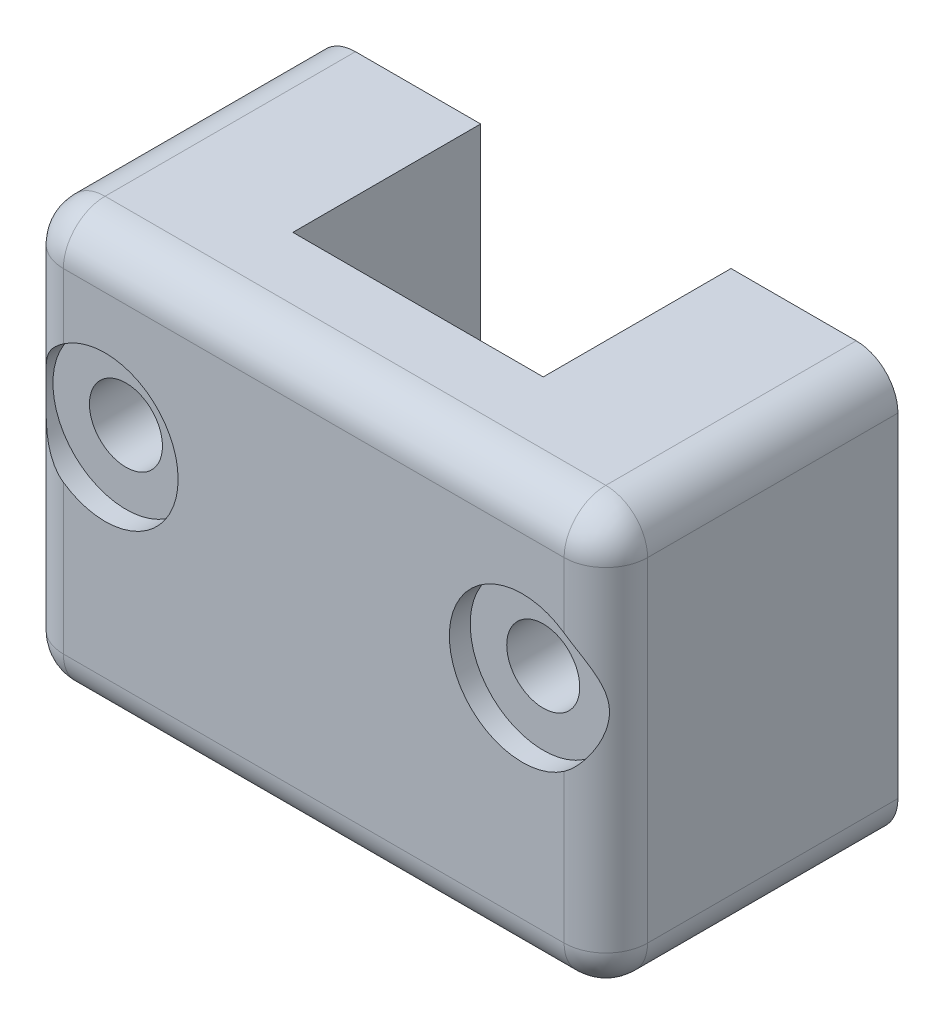
from build123d import *

# Parameters (mm, degrees)
SKETCH1_W                = 42
SKETCH1_H                = 14
BOSS_EXTRUDE1_DEPTH      = 20
SKETCH2_W                = 11
SKETCH2_H                = 10
CUT_EXTRUDE1_DEPTH       = 33.202484376
SKETCH3_W                = 11
SKETCH3_H                = 10
CUT_EXTRUDE2_DEPTH       = 33.202484376
SKETCH4_W                = 12
SKETCH4_H                = 10
CUT_EXTRUDE3_DEPTH       = 33.202484376
F_4_0_4_DIAMETER_HOLE1_D = 4
FILLET1_R                = 1
SKETCH7_W                = 53.135320533
SKETCH7_H                = 18.013507302
CUT_EXTRUDE4_DEPTH       = 1.5
SKETCH8_W                = 12
SKETCH8_H                = 12.5
CUT_EXTRUDE5_DEPTH       = 1.5
SKETCH9_W                = 20
SKETCH9_H                = 20
BOSS_EXTRUDE2_DEPTH      = 1
SKETCH10_W               = 3.48641985
SKETCH10_H               = 13.666765812
CUT_EXTRUDE6_DEPTH       = 3
SKETCH11_W               = 4.358024812
SKETCH11_H               = 13.509876918
CUT_EXTRUDE7_DEPTH       = 3
BOSS_EXTRUDE3_START      = 0.5
SKETCH14_W               = 12
SKETCH14_H               = 12.5
SKETCH14_R               = 2
BOSS_EXTRUDE3_DEPTH      = 0.5
FILLET7_R                = 3
BOSS_EXTRUDE4_START      = -14
SKETCH15_W               = 4
SKETCH15_H               = 20
BOSS_EXTRUDE4_DEPTH      = 14
SKETCH16_W               = 13.925462325
SKETCH16_H               = 21.292387115
SKETCH16_W_2             = 9.897316219
SKETCH16_H_2             = 21.744987801
CUT_EXTRUDE8_DEPTH       = 30.241451742
SKETCH17_W               = 12
SKETCH17_H               = 7.5
CUT_EXTRUDE9_DEPTH       = 1.5
SKETCH18_W               = 29.147036291
SKETCH18_H               = 2.174846481
CUT_EXTRUDE10_DEPTH      = 5.897378098
SKETCH19_W               = 12
SKETCH19_H               = 20
BOSS_EXTRUDE5_DEPTH      = 1.5
SKETCH20_W               = 4
SKETCH20_H               = 1.602621902
BOSS_EXTRUDE6_DEPTH      = 1.5
SKETCH24_R               = 1.75
CUT_EXTRUDE11_DEPTH      = 14
SKETCH25_R               = 3.5
CUT_EXTRUDE12_DEPTH      = 1
FILLET8_R                = 2


with BuildPart() as part:
    # Sketch1 → Boss-Extrude1 (new body)
    with BuildSketch(Plane.XZ.offset(6.25)):
        with Locations((0, 7)):
            Rectangle(SKETCH1_W, SKETCH1_H)
    extrude(amount=-BOSS_EXTRUDE1_DEPTH)

    # Sketch2 → Cut-Extrude1 (cut, through all)
    with BuildSketch(Plane(origin=(0, 13.75, 0), x_dir=(-1, 0, 0), z_dir=(0, 1, 0))):
        with Locations((-15.5, 9)):
            Rectangle(SKETCH2_W, SKETCH2_H)
    extrude(amount=-CUT_EXTRUDE1_DEPTH, mode=Mode.SUBTRACT)

    # Sketch3 → Cut-Extrude2 (cut, through all)
    with BuildSketch(Plane(origin=(0, 13.75, 0), x_dir=(-1, 0, 0), z_dir=(0, 1, 0))):
        with Locations((15.5, 9)):
            Rectangle(SKETCH3_W, SKETCH3_H)
    extrude(amount=-CUT_EXTRUDE2_DEPTH, mode=Mode.SUBTRACT)

    # Sketch4 → Cut-Extrude3 (cut, through all)
    with BuildSketch(Plane(origin=(0, 13.75, 0), x_dir=(-1, 0, 0), z_dir=(0, 1, 0))):
        with Locations((0, 5)):
            Rectangle(SKETCH4_W, SKETCH4_H)
    extrude(amount=-CUT_EXTRUDE3_DEPTH, mode=Mode.SUBTRACT)

    # Ø4.0 (4) Diameter Hole1 (through all)
    with Locations(Plane.XY.offset(4)):
        with Locations((15, 0), (-15, 0)):
            Hole(F_4_0_4_DIAMETER_HOLE1_D / 2)

    # Fillet1
    fillet1_edges = [part.edges().sort_by_distance(p)[0] for p in [
        (-21, -6.25, 2),
        (-21, 13.75, 2),
        (21, -6.25, 2),
        (21, 13.75, 2),
    ]]
    fillet(fillet1_edges, radius=FILLET1_R)

    # Sketch7 → Cut-Extrude4 (cut)
    with BuildSketch(Plane(origin=(0, 0, 0), x_dir=(-1, 0, 0), z_dir=(0, 0, -1))):
        with Locations((2.896644391, -1.154131749)):
            Rectangle(SKETCH7_W, SKETCH7_H)
    extrude(amount=-CUT_EXTRUDE4_DEPTH, mode=Mode.SUBTRACT)

    # Sketch8 → Cut-Extrude5 (cut)
    with BuildSketch(Plane(origin=(0, 0, 10), x_dir=(-1, 0, 0), z_dir=(0, 0, -1))):
        Rectangle(SKETCH8_W, SKETCH8_H)
    extrude(amount=-CUT_EXTRUDE5_DEPTH, mode=Mode.SUBTRACT)

    # Sketch9 → Boss-Extrude2 (add)
    with BuildSketch(Plane.XY.offset(14)):
        with Locations((0, 3.75)):
            Rectangle(SKETCH9_W, SKETCH9_H)
    extrude(amount=BOSS_EXTRUDE2_DEPTH)

    # Sketch10 → Cut-Extrude6 (cut)
    with BuildSketch(Plane.ZY.offset(21)):
        with Locations((2.776320836, -0.252765439)):
            Rectangle(SKETCH10_W, SKETCH10_H)
    extrude(amount=-CUT_EXTRUDE6_DEPTH, mode=Mode.SUBTRACT)

    # Sketch11 → Cut-Extrude7 (cut)
    with BuildSketch(Plane(origin=(21, 0, 0), x_dir=(0, 0, -1), z_dir=(1, 0, 0))):
        with Locations((-2.462543049, -0.261481489)):
            Rectangle(SKETCH11_W, SKETCH11_H)
    extrude(amount=-CUT_EXTRUDE7_DEPTH, mode=Mode.SUBTRACT)

    # Sketch14 → Boss-Extrude3 (add)
    # profile 1 of 2: a face of its own
    with BuildSketch(Plane(origin=(0, 0, 1.5), x_dir=(-1, 0, 0), z_dir=(0, 0, -1)).offset(BOSS_EXTRUDE3_START)):
        with Locations((12, 0)):
            Rectangle(SKETCH14_W, SKETCH14_H)
        with Locations(Location((15, 0, 0), (0, 0, 180))):
            Circle(SKETCH14_R, mode=Mode.SUBTRACT)
    # profile 2 of 2: a face of its own
    with BuildSketch(Plane(origin=(0, 0, 1.5), x_dir=(-1, 0, 0), z_dir=(0, 0, -1)).offset(BOSS_EXTRUDE3_START)):
        with Locations((-12, 0)):
            Rectangle(SKETCH14_W, SKETCH14_H)
        with Locations(Location((-15, 0, 0), (0, 0, 180))):
            Circle(SKETCH14_R, mode=Mode.SUBTRACT)
    extrude(amount=-BOSS_EXTRUDE3_DEPTH)

    # Fillet7
    # the kernel refuses this fillet: 3 mm, written as the material it takes off along each edge
    with BuildSketch(Plane(origin=(-18, -6.25, 1.5), x_dir=(1, 0, 0), z_dir=(0, 0, 1))) as fillet7_piece_1:
        with BuildLine():
            CenterArc((FILLET7_R, FILLET7_R), FILLET7_R, 180, 90)
            Line((0, FILLET7_R), (0, 0))
            Line((0, 0), (FILLET7_R, 0))
        make_face()
    extrude(amount=10, mode=Mode.SUBTRACT)
    with BuildSketch(Plane(origin=(18, -6.25, 11.5), x_dir=(-1, 0, 0), z_dir=(0, 0, -1))) as fillet7_piece_2:
        with BuildLine():
            CenterArc((FILLET7_R, FILLET7_R), FILLET7_R, 180, 90)
            Line((0, FILLET7_R), (0, 0))
            Line((0, 0), (FILLET7_R, 0))
        make_face()
    extrude(amount=18, mode=Mode.SUBTRACT)
    with BuildSketch(Plane(origin=(-18, 6.25, -6.5), x_dir=(1, 0, 0), z_dir=(0, 0, 1))) as fillet7_piece_3:
        with BuildLine():
            CenterArc((FILLET7_R, -FILLET7_R), FILLET7_R, 90, 90)
            Line((0, -FILLET7_R), (0, 0))
            Line((0, 0), (FILLET7_R, 0))
        make_face()
    extrude(amount=8, mode=Mode.SUBTRACT)
    with BuildSketch(Plane(origin=(-18, -6.25, -6.5), x_dir=(1, 0, 0), z_dir=(0, 0, 1))) as fillet7_piece_4:
        with BuildLine():
            CenterArc((FILLET7_R, FILLET7_R), FILLET7_R, 180, 90)
            Line((0, FILLET7_R), (0, 0))
            Line((0, 0), (FILLET7_R, 0))
        make_face()
    extrude(amount=8, mode=Mode.SUBTRACT)

    # Sketch15 → Boss-Extrude4 (add)
    with BuildSketch(Plane.XY.offset(15).offset(BOSS_EXTRUDE4_START)):
        with Locations((-12, 3.75)):
            Rectangle(SKETCH15_W, SKETCH15_H)
        with Locations((12, 3.75)):
            Rectangle(SKETCH15_W, SKETCH15_H)
    extrude(amount=BOSS_EXTRUDE4_DEPTH)

    # Sketch16 → Cut-Extrude8 (cut, through all)
    with BuildSketch(Plane.XY.offset(15)):
        with Locations((20.962731162, 3.103806442)):
            Rectangle(SKETCH16_W, SKETCH16_H)
        with Locations((-18.94865811, 2.877506099)):
            Rectangle(SKETCH16_W_2, SKETCH16_H_2)
    extrude(amount=-CUT_EXTRUDE8_DEPTH, mode=Mode.SUBTRACT)

    # Sketch17 → Cut-Extrude9 (cut)
    with BuildSketch(Plane(origin=(0, 0, 10), x_dir=(-1, 0, 0), z_dir=(0, 0, -1))):
        with Locations((0, 10)):
            Rectangle(SKETCH17_W, SKETCH17_H)
    extrude(amount=-CUT_EXTRUDE9_DEPTH, mode=Mode.SUBTRACT)

    # Sketch18 → Cut-Extrude10 (cut)
    with BuildSketch(Plane(origin=(0, 7.852621902, 0), x_dir=(-1, 0, 0), z_dir=(0, -1, 0))):
        with Locations((-0.573518146, 0.087423241)):
            Rectangle(SKETCH18_W, SKETCH18_H)
    extrude(amount=-CUT_EXTRUDE10_DEPTH, mode=Mode.SUBTRACT)

    # Sketch19 → Boss-Extrude5 (add)
    with BuildSketch(Plane(origin=(0, 0, 11.5), x_dir=(-1, 0, 0), z_dir=(0, 0, -1))):
        with Locations((0, 3.75)):
            Rectangle(SKETCH19_W, SKETCH19_H)
    extrude(amount=BOSS_EXTRUDE5_DEPTH)

    # Sketch20 → Boss-Extrude6 (add)
    with BuildSketch(Plane(origin=(0, 0, 1), x_dir=(-1, 0, 0), z_dir=(0, 0, -1))):
        with Locations((-8, 7.051310951)):
            Rectangle(SKETCH20_W, SKETCH20_H)
        with Locations((8, 7.051310951)):
            Rectangle(SKETCH20_W, SKETCH20_H)
    extrude(amount=-BOSS_EXTRUDE6_DEPTH)

    # Sketch24 → Cut-Extrude11 (cut)
    with BuildSketch(Plane(origin=(0, 0, 1), x_dir=(-1, 0, 0), z_dir=(0, 0, -1))):
        with Locations((-10, 5.75)):
            Circle(SKETCH24_R)
        with Locations((10, 5.75)):
            Circle(SKETCH24_R)
    extrude(amount=-CUT_EXTRUDE11_DEPTH, mode=Mode.SUBTRACT)

    # Sketch25 → Cut-Extrude12 (cut)
    with BuildSketch(Plane.XY.offset(15)):
        with Locations((10, 5.75)):
            Circle(SKETCH25_R)
        with Locations((-10, 5.75)):
            Circle(SKETCH25_R)
    extrude(amount=-CUT_EXTRUDE12_DEPTH, mode=Mode.SUBTRACT)

    # Fillet8
    # the kernel refuses this fillet: 2 mm, written as the material it takes off along each edge
    with BuildSketch(Plane(origin=(12, -4.25, 13), x_dir=(0, 0, 1), z_dir=(1, 0, 0))) as fillet8_piece_1_section:
        Polygon((0, 0), (FILLET8_R, 0), (FILLET8_R, FILLET8_R), (0, FILLET8_R), align=None)
    fillet8_piece_1 = extrude(amount=FILLET8_R, mode=Mode.PRIVATE)
    fillet8_piece_1 = fillet8_piece_1 - Plane(origin=(12, -4.25, 13), x_dir=(0, 0.7071067811865475, -0.7071067811865475), z_dir=(1, 0, 0)) * Sphere(FILLET8_R, mode=Mode.PRIVATE)
    add(fillet8_piece_1, mode=Mode.SUBTRACT)
    with BuildSketch(Plane(origin=(-12, -4.25, 13), x_dir=(0, -1, 0), z_dir=(0, 0, 1))) as fillet8_piece_2_section:
        Polygon((0, 0), (FILLET8_R, 0), (FILLET8_R, -FILLET8_R), (0, -FILLET8_R), align=None)
    fillet8_piece_2 = extrude(amount=FILLET8_R, mode=Mode.PRIVATE)
    fillet8_piece_2 = fillet8_piece_2 - Plane(origin=(-12, -4.25, 13), x_dir=(0.7071067811865475, 0.7071067811865475, 0), z_dir=(0, 0, 1)) * Sphere(FILLET8_R, mode=Mode.PRIVATE)
    add(fillet8_piece_2, mode=Mode.SUBTRACT)
    with BuildSketch(Plane(origin=(-12, 11.75, 13), x_dir=(0, 0, 1), z_dir=(0, 1, 0))) as fillet8_piece_3_section:
        Polygon((0, 0), (FILLET8_R, 0), (FILLET8_R, -FILLET8_R), (0, -FILLET8_R), align=None)
    fillet8_piece_3 = extrude(amount=FILLET8_R, mode=Mode.PRIVATE)
    fillet8_piece_3 = fillet8_piece_3 - Plane(origin=(-12, 11.75, 13), x_dir=(0.7071067811865475, 0, -0.7071067811865475), z_dir=(0, 1, 0)) * Sphere(FILLET8_R, mode=Mode.PRIVATE)
    add(fillet8_piece_3, mode=Mode.SUBTRACT)
    with BuildSketch(Plane(origin=(12, 11.75, 13), x_dir=(0, 1, 0), z_dir=(1, 0, 0))) as fillet8_piece_4_section:
        Polygon((0, 0), (FILLET8_R, 0), (FILLET8_R, FILLET8_R), (0, FILLET8_R), align=None)
    fillet8_piece_4 = extrude(amount=FILLET8_R, mode=Mode.PRIVATE)
    fillet8_piece_4 = fillet8_piece_4 - Plane(origin=(12, 11.75, 13), x_dir=(0, -0.7071067811865475, -0.7071067811865475), z_dir=(1, 0, 0)) * Sphere(FILLET8_R, mode=Mode.PRIVATE)
    add(fillet8_piece_4, mode=Mode.SUBTRACT)
    with BuildSketch(Plane(origin=(12, -6.25, 15), x_dir=(0, 1, 0), z_dir=(-1, 0, 0))) as fillet8_piece_5:
        with BuildLine():
            CenterArc((FILLET8_R, FILLET8_R), FILLET8_R, 180, 90)
            Line((0, FILLET8_R), (0, 0))
            Line((0, 0), (FILLET8_R, 0))
        make_face()
    extrude(amount=24, mode=Mode.SUBTRACT)
    with BuildSketch(Plane(origin=(-12, 13.75, 15), x_dir=(0, 0, -1), z_dir=(1, 0, 0))) as fillet8_piece_6:
        with BuildLine():
            CenterArc((FILLET8_R, -FILLET8_R), FILLET8_R, 90, 90)
            Line((0, -FILLET8_R), (0, 0))
            Line((0, 0), (FILLET8_R, 0))
        make_face()
    extrude(amount=24, mode=Mode.SUBTRACT)
    with BuildSketch(Plane(origin=(-14, -6.25, -4), x_dir=(1, 0, 0), z_dir=(0, 0, 1))) as fillet8_piece_7:
        with BuildLine():
            CenterArc((FILLET8_R, FILLET8_R), FILLET8_R, 180, 90)
            Line((0, FILLET8_R), (0, 0))
            Line((0, 0), (FILLET8_R, 0))
        make_face()
    extrude(amount=17, mode=Mode.SUBTRACT)
    with BuildSketch(Plane(origin=(-14, 11.75, 15), x_dir=(1, 0, 0), z_dir=(0, -1, 0)), Plane(origin=(14, 11.75, 15), x_dir=(0, 0, -1), z_dir=(0, -1, 0))) as fillet8_piece_8:
        with BuildLine():
            CenterArc((FILLET8_R, -FILLET8_R), FILLET8_R, 90, 90)
            Line((0, -FILLET8_R), (0, 0))
            Line((0, 0), (FILLET8_R, 0))
        make_face()
    extrude(amount=16, mode=Mode.SUBTRACT)
    with BuildSketch(Plane(origin=(14, -6.25, 13), x_dir=(0, 1, 0), z_dir=(0, 0, -1)), Plane(origin=(14, 13.75, -4), x_dir=(0, -1, 0), z_dir=(0, 0, 1)), Plane(origin=(-14, 13.75, -4), x_dir=(1, 0, 0), z_dir=(0, 0, 1))) as fillet8_piece_9:
        with BuildLine():
            CenterArc((FILLET8_R, -FILLET8_R), FILLET8_R, 90, 90)
            Line((0, -FILLET8_R), (0, 0))
            Line((0, 0), (FILLET8_R, 0))
        make_face()
    extrude(amount=17, mode=Mode.SUBTRACT)


solid = part.part
